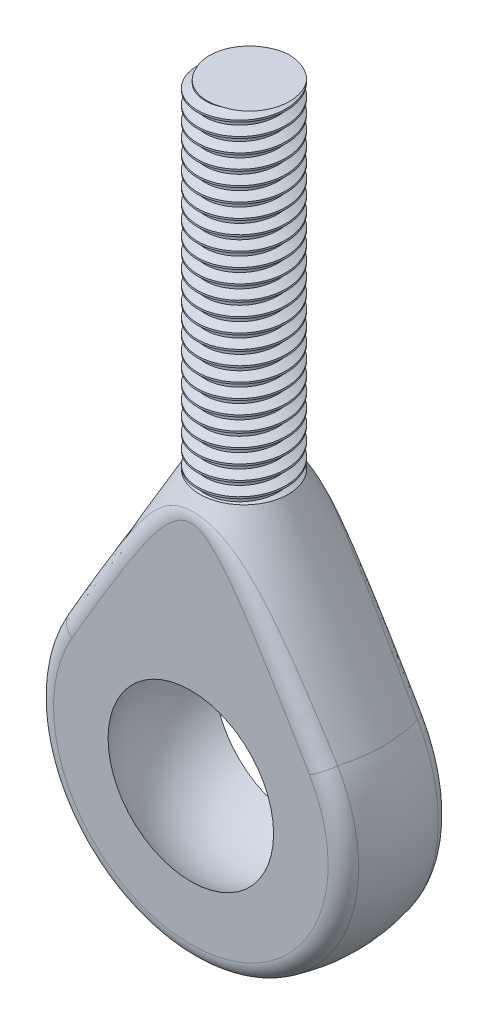
from build123d import *

# Parameters (mm, degrees)
SKETCH3_W          = 20.182459996
SKETCH3_H          = 66
CUT_EXTRUDE6_DEPTH = 37.249137921
THREAD1_PITCH      = 0.8
FILLET1_R          = 1


with BuildPart() as part:
    # Sketch1 one side → Revolve2 (revolve)
    with BuildSketch(Plane.XY):
        with BuildLine():
            Line((0, 5.55), (0, 33))
            Line((0, 33), (-2.5, 33))
            Line((-2.5, 33), (-2.5, 14))
            Line((-2.5, 14), (-7.861216709, 4.381925588))
            ThreePointArc((-7.861216709, 4.381925588), (-7.76006863, -4.558654939), (0, -9))
            Line((0, -9), (0, -5.55))
            ThreePointArc((0, -5.55), (-5.55, 0), (0, 5.55))
        make_face()
    revolve(axis=Axis((0, -319.647511039, 0), (0, 1, 0)))

    # Sketch3 → Cut-Extrude6 (cut, through all)
    with BuildSketch(Plane.XY.offset(3)):
        Rectangle(SKETCH3_W, SKETCH3_H)
    cut_extrude6 = extrude(amount=CUT_EXTRUDE6_DEPTH, mode=Mode.SUBTRACT)

    # Mirror1: Cut-Extrude6 across plane
    add(cut_extrude6.mirror(Plane.XY), mode=Mode.SUBTRACT)

    # Thread1: the profile of Thread Profile1 profile screwed along a right-hand helix of 25 turns, 8 arcs to a turn; built about Z, then put on its axis
    thread1_z = Axis((0, 0, 0), (0, 0, 1))
    thread1_corners = [(2.5003, 0, -0.000173205), (2.5003, 0, 0.700173203), (2.0669873, 0, 0.449999999), (2.0669873, 0, 0.249999999)]
    with BuildLine(mode=Mode.PRIVATE) as thread1_profile:
        Line(thread1_corners[0], thread1_corners[1])
        Line(thread1_corners[1], thread1_corners[2])
        Line(thread1_corners[2], thread1_corners[3])
        Line(thread1_corners[3], thread1_corners[0])
    thread1_cap = Face(thread1_profile.wire())
    thread1_turn_angles = [0, 22.5, 45, 67.5, 90, 112.5, 135, 157.5, 180, 202.5, 225, 247.5, 270, 292.5, 315, 337.5, 360]
    thread1_turn_weights = [1, 0.9238795325112867, 1, 0.9238795325112867, 1, 0.9238795325112867, 1, 0.9238795325112867, 1, 0.9238795325112867, 1, 0.9238795325112867, 1, 0.9238795325112867, 1, 0.9238795325112867, 1]
    thread1_turn_rails = [Edge.make_bspline([Vector(p[0], p[1], 0).rotate(thread1_z, thread1_turn_angles[k]) / thread1_turn_weights[k] + Vector(0, 0, p[2] + THREAD1_PITCH * thread1_turn_angles[k] / 360) for k in range(17)], [0, 0, 0, 1, 1, 2, 2, 3, 3, 4, 4, 5, 5, 6, 6, 7, 7, 8, 8, 8], 2, thread1_turn_weights) for p in thread1_corners]
    thread1_turn_sides = [Face.make_surface_from_curves(thread1_turn_rails[p[0]], thread1_turn_rails[p[1]]) for p in [(0, 1), (1, 2), (2, 3), (3, 0)]]
    thread1 = Plane(origin=(0, 34, 0), x_dir=(-1, 0, 0), z_dir=(0, -1, 0)) * Solid(Shell([*[p.moved(Location((0, 0, THREAD1_PITCH * i))) for i in range(25) for p in thread1_turn_sides], thread1_cap, thread1_cap.rotate(thread1_z, 9000).moved(Location((0, 0, THREAD1_PITCH * 9000 / 360)))]))
    add(thread1, mode=Mode.SUBTRACT)

    # Fillet1
    fillet1_edges = [part.edges().sort_by_distance(p)[0] for p in [
        (0.000367033, 13.102995144, 3),
        (0.000367033, 13.102995144, -3),
    ]]
    fillet(fillet1_edges, radius=FILLET1_R)


solid = part.part
